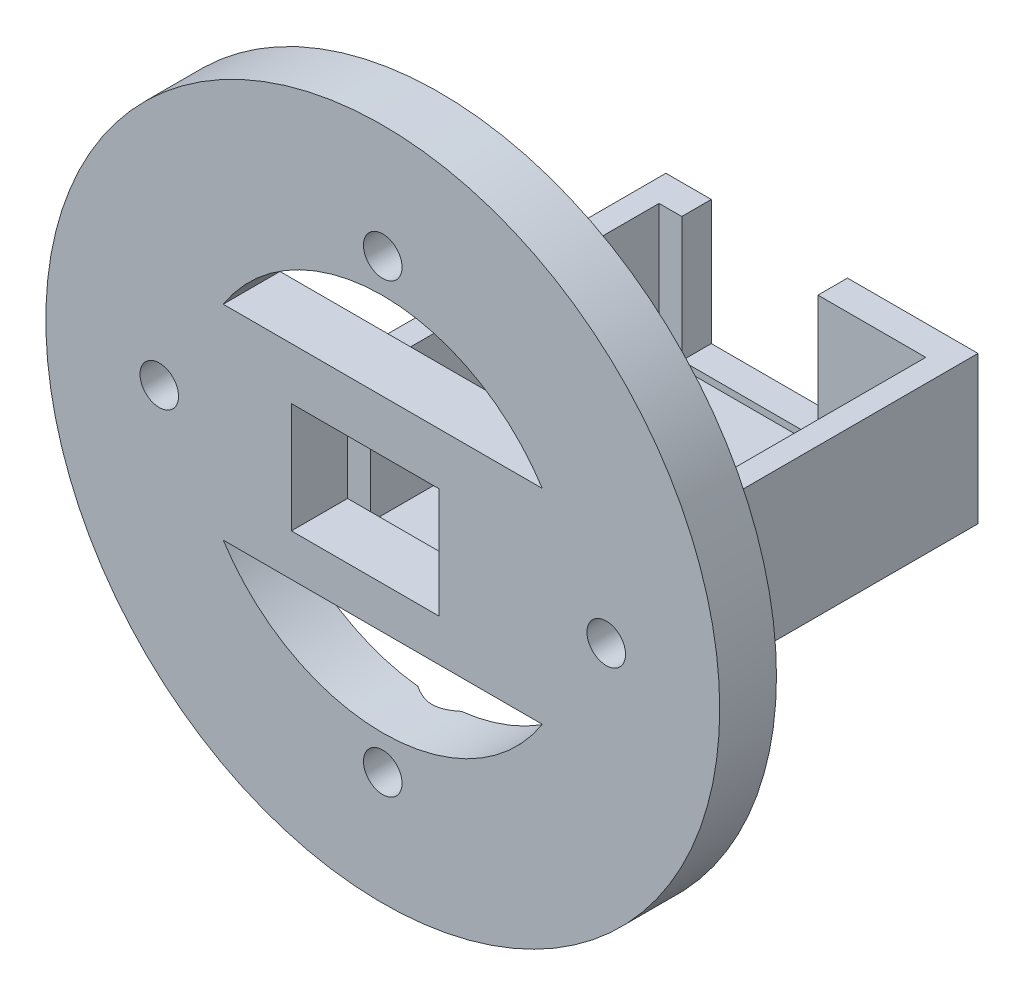
from build123d import *

# Parameters (mm, degrees)
SKETCH1_R                                      = 29.692527183
SKETCH1_R_2                                    = 22.692527183
SKETCH1_R_3                                    = 19.692527183
SKETCH1_R_4                                    = 16.692527183
BOSS_EXTRUDE1_DEPTH                            = 5
SKETCH9_W                                      = 27.5
SKETCH9_H                                      = 28
BOSS_EXTRUDE2_DEPTH                            = 7.5
SKETCH10_W                                     = 23.5
SKETCH10_H                                     = 25.45
CUT_EXTRUDE1_DEPTH                             = 6.1
SKETCH12_W                                     = 12
SKETCH12_H                                     = 11
CUT_EXTRUDE2_DEPTH                             = 3
SKETCH11_W                                     = 13
SKETCH11_H                                     = 9.717675131
CUT_EXTRUDE3_DEPTH                             = 4.947760199
CSK_FOR_M3_FLAT_HEAD_MACHINE_SCREW1_AT_2_COUNT = 2
CSK_FOR_M3_FLAT_HEAD_MACHINE_SCREW1_AT_2_PITCH = 27.84943902
CSK_FOR_M3_FLAT_HEAD_MACHINE_SCREW1_AT_3_COUNT = 2
CSK_FOR_M3_FLAT_HEAD_MACHINE_SCREW1_AT_3_PITCH = 27.84943902
CSK_FOR_M3_FLAT_HEAD_MACHINE_SCREW1_AT_4_COUNT = 2
CSK_FOR_M3_FLAT_HEAD_MACHINE_SCREW1_AT_4_PITCH = 39.385054366
SPLIT1_START                                   = 5.5
SPLIT1_OUTLINE_W                               = 27.5
SPLIT1_OUTLINE_H                               = 28
SPLIT1_DEPTH                                   = 2
SPLIT1_START_2                                 = -28
SPLIT1_2_DEPTH                                 = 28
SPLIT1_3_OUTLINE_W                             = 23.5
SPLIT1_3_OUTLINE_H                             = 0.6
SPLIT1_3_DEPTH                                 = 2.602239801


# Read off the part's stored shape, not the designer's step: Split1
with BuildPart() as part:
    # Sketch1 → Boss-Extrude1 (new body)
    # profile 1 of 4: a face of its own
    with BuildSketch(Plane(origin=(0, 0, 0), x_dir=(-1, 0, 0), z_dir=(0, 0, 1))):
        with Locations(Location((0, 0, 0), (0, 0, 180))):
            Circle(SKETCH1_R)
        Circle(SKETCH1_R_2, mode=Mode.SUBTRACT)
    # profile 2 of 4: a face of its own
    with BuildSketch(Plane(origin=(0, 0, 0), x_dir=(-1, 0, 0), z_dir=(0, 0, 1))):
        Circle(SKETCH1_R_2)
        Circle(SKETCH1_R_3, mode=Mode.SUBTRACT)
    # profile 3 of 4: a face of its own
    with BuildSketch(Plane(origin=(0, 0, 0), x_dir=(-1, 0, 0), z_dir=(0, 0, 1))):
        Circle(SKETCH1_R_3)
        Circle(SKETCH1_R_4, mode=Mode.SUBTRACT)
    # profile 4 of 4: a face of its own
    with BuildSketch(Plane(origin=(0, 0, 0), x_dir=(-1, 0, 0), z_dir=(0, 0, 1))):
        with BuildLine():
            Line((14.058465911, 9), (-14.058465911, 9))
            ThreePointArc((-14.058465911, 9), (-16.692527183, 0), (-14.058465911, -9))
            Line((-14.058465911, -9), (14.058465911, -9))
            ThreePointArc((14.058465911, -9), (16.020483578, -4.688770595), (16.692527183, 0))
            ThreePointArc((16.692527183, 0), (16.020483578, 4.688770595), (14.058465911, 9))
        make_face()
    extrude(amount=BOSS_EXTRUDE1_DEPTH)

    # Sketch9 → Boss-Extrude2 (add, symmetric)
    with BuildSketch(Plane(origin=(0, 0, 0), x_dir=(1, 0, 0), z_dir=(0, 1, 0))):
        with Locations((5.7, 14)):
            Rectangle(SKETCH9_W, SKETCH9_H)
    extrude(amount=BOSS_EXTRUDE2_DEPTH, both=True)

    # Sketch10 → Cut-Extrude1 (cut, symmetric)
    with BuildSketch(Plane(origin=(0, 0, 0), x_dir=(1, 0, 0), z_dir=(0, 1, 0))):
        with Locations((5.7, 12.672760199)):
            Rectangle(SKETCH10_W, SKETCH10_H)
    extrude(amount=CUT_EXTRUDE1_DEPTH, both=True, mode=Mode.SUBTRACT)

    # Sketch12 → Cut-Extrude2 (cut)
    with BuildSketch(Plane.XY.offset(-28)):
        with Locations((1.95, 0)):
            Rectangle(SKETCH12_W, SKETCH12_H)
    extrude(amount=CUT_EXTRUDE2_DEPTH, mode=Mode.SUBTRACT)

    # Sketch11 → Cut-Extrude3 (cut)
    with BuildSketch(Plane.XY.offset(5)):
        with Locations((-1.55, -0.433824782)):
            Rectangle(SKETCH11_W, SKETCH11_H)
    extrude(amount=-CUT_EXTRUDE3_DEPTH, mode=Mode.SUBTRACT)

    # Sketch13 → CSK for M3 Flat Head Machine Screw1 (revolve, cut)
    with BuildSketch(Plane.YZ.offset(-19.692527183)):
        Polygon((0, 0), (0, 13.021463052), (1.7, 12), (1.7, 1.95), (3.65, 0), align=None)
    csk_for_m3_flat_head_machine_screw1 = revolve(axis=Axis((-19.692527183, 0, -6.35), (0, 0, 1)), mode=Mode.SUBTRACT)

    # CSK for M3 Flat Head Machine Screw1 at 2: CSK for M3 Flat Head Machine Screw1 ×2
    with Locations(*[Vector(0.7071067811865476, -0.7071067811865475, 0) * (i * CSK_FOR_M3_FLAT_HEAD_MACHINE_SCREW1_AT_2_PITCH) for i in range(1, CSK_FOR_M3_FLAT_HEAD_MACHINE_SCREW1_AT_2_COUNT)]):
        add(csk_for_m3_flat_head_machine_screw1, mode=Mode.SUBTRACT)

    # CSK for M3 Flat Head Machine Screw1 at 3: CSK for M3 Flat Head Machine Screw1 ×2
    with Locations(*[Vector(0.7071067811865476, 0.7071067811865475, 0) * (i * CSK_FOR_M3_FLAT_HEAD_MACHINE_SCREW1_AT_3_PITCH) for i in range(1, CSK_FOR_M3_FLAT_HEAD_MACHINE_SCREW1_AT_3_COUNT)]):
        add(csk_for_m3_flat_head_machine_screw1, mode=Mode.SUBTRACT)

    # CSK for M3 Flat Head Machine Screw1 at 4: CSK for M3 Flat Head Machine Screw1 ×2
    with Locations(*[(i * CSK_FOR_M3_FLAT_HEAD_MACHINE_SCREW1_AT_4_PITCH, 0, 0) for i in range(1, CSK_FOR_M3_FLAT_HEAD_MACHINE_SCREW1_AT_4_COUNT)]):
        add(csk_for_m3_flat_head_machine_screw1, mode=Mode.SUBTRACT)

    # Split1 outline → Split1 (cut)
    with BuildSketch(Plane(origin=(0, 0, 0), x_dir=(1, 0, 0), z_dir=(0, 1, 0)).offset(SPLIT1_START)):
        with Locations((5.7, 14)):
            Rectangle(SPLIT1_OUTLINE_W, SPLIT1_OUTLINE_H)
    extrude(amount=SPLIT1_DEPTH, mode=Mode.SUBTRACT)


with BuildPart() as body_2:
    # Split1 2 outline → Split1 2 (new body)
    with BuildSketch(Plane.XY.offset(SPLIT1_START_2)):
        Polygon((-8.05, 5.5), (-6.05, 5.5), (-6.05, 6.1), (17.45, 6.1), (17.45, 5.5), (19.45, 5.5), (19.45, 7.5), (-8.05, 7.5), align=None)
    extrude(amount=SPLIT1_2_DEPTH)

    # Split1 3 outline → Split1 3 (add)
    with BuildSketch(Plane.XY.offset(SPLIT1_START_2)):
        with Locations((5.7, 5.8)):
            Rectangle(SPLIT1_3_OUTLINE_W, SPLIT1_3_OUTLINE_H)
    extrude(amount=SPLIT1_3_DEPTH)


solid = part.part
